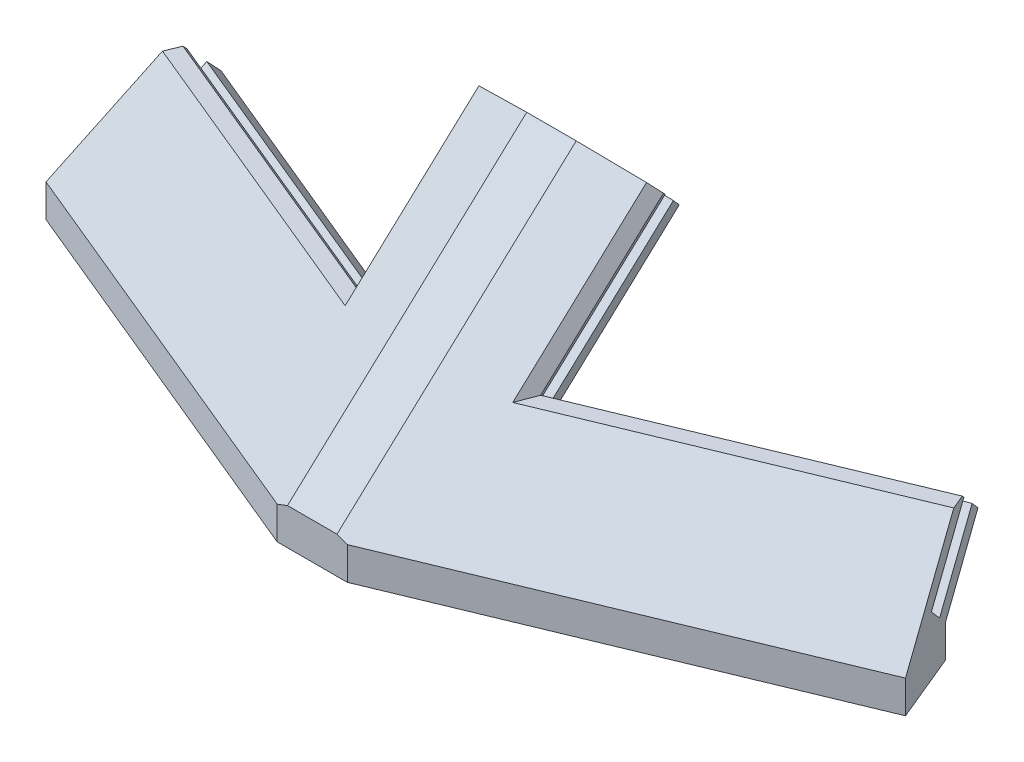
from build123d import *

# Parameters (mm, degrees)
SKETCH1_W                = 214.0895226738578
SKETCH1_H                = 271.0335668448457
BOSS_EXTRUDE1_DEPTH      = 10
SKETCH3_W                = 107.0447613369289
SKETCH3_H                = 271.0335668448457
CUT_EXTRUDE1_DEPTH       = 252.25359017903727
CUT_EXTRUDE2_DEPTH       = 249.55642867000518
BOSS_EXTRUDE3_DEPTH      = 40
CUT_EXTRUDE3_START       = -165.689856025
CUT_EXTRUDE3_DEPTH       = 205.862728092
CUT_EXTRUDE4_DEPTH       = 250.9605933606232
CUT_EXTRUDE5_DEPTH       = 250.96059336062322
BOSS_EXTRUDE5_DEPTH      = 45.000000000000014
CUT_EXTRUDE7_DEPTH       = 253.78419033582136
CUT_EXTRUDE9_DEPTH       = 253.78419033582136
CUT_EXTRUDE10_DEPTH      = 105
BOSS_EXTRUDE6_DEPTH      = 13.546139965279659
BOSS_EXTRUDE7_DEPTH      = 30
CUT_EXTRUDE12_DEPTH      = 30
CUT_EXTRUDE13_DEPTH      = 30
CUT_EXTRUDE14_DEPTH      = 30
CUT_EXTRUDE14_DEPTH_BACK = 101.66514829221025
BOSS_EXTRUDE8_DEPTH      = 5.2
CHAMFER1_START           = 223.359720619
CHAMFER1_OUTLINE_W       = 14
CHAMFER1_OUTLINE_H       = 9.000000000000002
CHAMFER1_DEPTH           = 3.640279381
CHAMFER3_START           = 159.35770891
CHAMFER3_OUTLINE_W       = 10
CHAMFER3_OUTLINE_H       = 51.999999999999986
CHAMFER3_DEPTH           = 1.64229109
CHAMFER4_SIZE            = 1.7


with BuildPart() as part:
    # Sketch1 → Boss-Extrude1 (new body)
    with BuildSketch(Plane(origin=(0, 0, 0), x_dir=(1, 0, 0), z_dir=(0, 1, 0))):
        with Locations((-3.148375333439077, -90.06211454589605)):
            Rectangle(SKETCH1_W, SKETCH1_H)
    extrude(amount=BOSS_EXTRUDE1_DEPTH)

    # Sketch3 → Cut-Extrude1 (cut, through all)
    with BuildSketch(Plane(origin=(0, 10, 0), x_dir=(1, 0, 0), z_dir=(0, 1, 0))):
        with Locations((-56.67075600190353, -90.06211454589605)):
            Rectangle(SKETCH3_W, SKETCH3_H)
    extrude(amount=-CUT_EXTRUDE1_DEPTH, mode=Mode.SUBTRACT)

    # Sketch4 → Cut-Extrude2 (cut, through all)
    with BuildSketch(Plane(origin=(0, 10, 0), x_dir=(1, 0, 0), z_dir=(0, 1, 0))):
        Polygon((103.89638600348982, -181.2395060415717), (100.8349185445691, -173.8484697814814), (9.99658424143476, 45.454668876526796), (103.89638600348982, 45.454668876526796), align=None)
    extrude(amount=-CUT_EXTRUDE2_DEPTH, mode=Mode.SUBTRACT)

    # Sketch6 → Boss-Extrude3 (add, along a direction that is not the sketch's normal)
    with BuildSketch(Plane(origin=(0, 10, 0), x_dir=(1, 0, 0), z_dir=(0, 1, 0))):
        Polygon((99.57206321776432, -170.7996673241942), (103.89638600348982, -181.2395060415717), (-3.148375333439077, -225.57889796831887), (-3.148375333439077, -213.34786610501484), align=None)
    extrude(amount=BOSS_EXTRUDE3_DEPTH, dir=(-0.2705980500730979, 0.7071067811865489, -0.6532814824381872))

    # Cut-Extrude3: read off the stored shape, not the designer's step
    # Cut-Extrude3 outline → Cut-Extrude3 (cut)
    with BuildSketch(Plane(origin=(0, 0, 0), x_dir=(1, 0, 0), z_dir=(0, 0.6785983445458481, -0.7345095552677544)).offset(CUT_EXTRUDE3_START)):
        Polygon((-3.148375333, -165), (-3.148375333, -152.122604304), (-13.972297336, -155.165042499), (-15, -155.45391393), (-15, -165), align=None)
    extrude(amount=CUT_EXTRUDE3_DEPTH, mode=Mode.SUBTRACT)

    # Sketch8 → Cut-Extrude4 (cut, through all)
    with BuildSketch(Plane(origin=(0, 10, 0), x_dir=(1, 0, 0), z_dir=(0, 1, 0))):
        Polygon((-3.1483753334390765, -225.5788979683189), (103.89638600348982, -181.2395060415717), (103.89638600348982, -225.57889796831887), align=None)
    extrude(amount=-CUT_EXTRUDE4_DEPTH, mode=Mode.SUBTRACT)

    # Sketch9 → Cut-Extrude5 (cut, through all)
    with BuildSketch(Plane(origin=(0, 10, 0), x_dir=(1, 0, 0), z_dir=(0, 1, 0))):
        Polygon((-3.1483753334390765, -213.34786610501484), (99.57206321776434, -170.7996673241942), (9.99658424143476, 45.454668876526796), (-3.148375333439077, 45.454668876526796), align=None)
    extrude(amount=-CUT_EXTRUDE5_DEPTH, mode=Mode.SUBTRACT)

    # Sketch13 → Boss-Extrude5 (add)
    with BuildSketch(Plane.XZ):
        Polygon((-3.1483753334390765, 225.5788979683189), (-3.1483753334390765, 213.34786610501484), (99.57206321776434, 170.7996673241942), (103.89638600348982, 181.23950604157167), align=None)
    extrude(amount=BOSS_EXTRUDE5_DEPTH)

    # Sketch14 → Cut-Extrude7 (cut, through all)
    with BuildSketch(Plane(origin=(24.60327067321852, 0, -10.191008391583336), x_dir=(-0.38268343236508967, 0, -0.9238795325112868), z_dir=(0.9238795325112867, 0, -0.3826834323650896))):
        Polygon((-178.9186244729457, 38.28427124746196), (-173.2686244729457, 32.63427124746195), (-167.6186244729457, 38.28427124746196), align=None)
    extrude(amount=-CUT_EXTRUDE7_DEPTH, mode=Mode.SUBTRACT)

    # Sketch21 → Cut-Extrude9 (cut, through all)
    with BuildSketch(Plane(origin=(24.60327067321852, 0, -10.191008391583336), x_dir=(-0.38268343236508967, 0, -0.9238795325112868), z_dir=(0.9238795325112867, 0, -0.3826834323650896))):
        Polygon((-178.9186244729457, 38.28427124746196), (-173.26862447294567, 32.63427124746195), (-186.71050756498246, 19.192388155425135), (-188.37220850077088, 20.854089091213513), (-197.564596656196, 11.661700935788378), (-199.8911947846192, 13.988299064211581), (-190.69880662919408, 23.180687219636717), (-192.3605075649825, 24.84238815542509), align=None)
    extrude(amount=-CUT_EXTRUDE9_DEPTH, mode=Mode.SUBTRACT)

    # Sketch26 → Cut-Extrude10 (cut)
    with BuildSketch(Plane(origin=(24.60327067321852, 0, -10.191008391583336), x_dir=(-0.38268343236508967, 0, -0.9238795325112868), z_dir=(0.9238795325112867, 0, -0.3826834323650896))):
        Polygon((-195.9028957204076, -45.000000000000014), (-207.2028957204075, -45.000000000000014), (-207.20289572040753, 4.999999999999999), (-204.20289572040753, 4.999999999999999), (-204.20289572040753, 10.2), (-198.9028957204076, 10.200000000000001), (-198.9028957204076, 5), (-195.9028957204076, 5), align=None)
    extrude(amount=-CUT_EXTRUDE10_DEPTH, mode=Mode.SUBTRACT)

    # Sketch27 → Boss-Extrude6 (add, along a direction that is not the sketch's normal)
    with BuildSketch(Plane(origin=(35.57097911044696, -92.95144786020374, 85.87594019533113), x_dir=(0.9626924198811571, 0.19875685341551327, -0.18362738881693624), z_dir=(-0.2705980500730966, 0.7071067811865525, -0.6532814824381838))):
        Polygon((-40.21986009681666, -165.94075499699434), (-39.260177114555994, -165.65967035927952), (-38.33532246822035, -168.81732163602243), (-40.219860096816646, -169.36928992803706), align=None)
    extrude(amount=BOSS_EXTRUDE6_DEPTH, dir=(0, 0.6785983445458494, -0.7345095552677533))

    # Sketch28 → Boss-Extrude7 (add, along a direction that is not the sketch's normal)
    with BuildSketch(Plane(origin=(32.05320445949652, -83.75905970477851, 77.38328092363429), x_dir=(0.9626924198811573, 0.1987568534155131, -0.18362738881693524), z_dir=(-0.27059805007309584, 0.7071067811865541, -0.6532814824381823))):
        Polygon((-23.13019805487444, -160.93530887309606), (-23.79074695350427, -158.6800538647835), (-36.56575980652385, -162.4217684996877), (-36.565759806523836, -170.74775403356227), (-21.544794509909032, -166.34821515815156), (-22.205343408538862, -164.09296014983897), (-34.68122217792752, -167.7470604401317), (-35.606076824263106, -164.58940916338878), align=None)
    extrude(amount=BOSS_EXTRUDE7_DEPTH, dir=(0, 0.6785983445458483, -0.7345095552677544))

    # Sketch29 → Cut-Extrude12 (cut)
    with BuildSketch(Plane(origin=(41.559974826961344, 108.60144786020382, 100.33465487913432), x_dir=(0.9626924198811563, -0.1987568534155138, -0.18362738881693985), z_dir=(0.2705980500730995, 0.7071067811865461, 0.6532814824381895))):
        Polygon((-46.44094960872295, -107.03174707988727), (-31.419984312108156, -107.03174707988727), (-31.41998431210815, -102.63220820447661), align=None)
    extrude(amount=-CUT_EXTRUDE12_DEPTH, mode=Mode.SUBTRACT)

    # Sketch30 → Cut-Extrude13 (cut)
    with BuildSketch(Plane(origin=(-72.40408024046648, 0, 29.990752006750984), x_dir=(-0.3826834323650857, 0, -0.9238795325112884), z_dir=(0.9238795325112884, 0, -0.3826834323650857))):
        Polygon((-207.20289572040787, 4.610357956966736), (-207.20289572040795, -45.000000000000014), (-195.90289572040788, -45.000000000000014), (-195.90289572040788, 4.6103579569667374), (-195.9028957204076, 5), (-207.20289572040755, 4.999999999999999), align=None)
    extrude(amount=-CUT_EXTRUDE13_DEPTH, mode=Mode.SUBTRACT)

    # Sketch31 → Cut-Extrude14 (cut, two sides: drawn at the far end of the back side and taken through both)
    with BuildSketch(Plane(origin=(74.968792544546, 0, 180.99067571577757), x_dir=(-0.9238795325112865, 0, 0.38268343236509056), z_dir=(-0.38268343236509056, 0, -0.9238795325112865)).offset(-CUT_EXTRUDE14_DEPTH_BACK)):
        Polygon((18.0534132200626, -1.4270293234233122), (-26.630388278374163, -1.4270293234233173), (-26.630388278374163, 30.311404517874507), (18.0534132200626, 30.311404517874507), align=None)
    extrude(amount=CUT_EXTRUDE14_DEPTH + CUT_EXTRUDE14_DEPTH_BACK, mode=Mode.SUBTRACT)

    # Sketch33 → Boss-Extrude8 (add)
    with BuildSketch(Plane(origin=(1.28e-15, 10.200000000000065, 3.08e-15), x_dir=(-1, 1.3e-16, 0), z_dir=(-1.3e-16, -1, -3e-16))):
        Polygon((-61.46588606719166, -195.56761797257994), (-56.84648840463523, -197.48103513440537), (-54.81826621310026, -192.5844736120956), (-59.437663875656696, -190.67105645027016), align=None)
    extrude(amount=BOSS_EXTRUDE8_DEPTH)

    # Mirror4: part across plane


with BuildPart() as part_1:
    add(part.part)
    add(part.part.mirror(Plane(origin=(-3.148375333439077, 0, 225.57889796831887), x_dir=(0, 0, 1), z_dir=(1, 0, 0))))

    # Chamfer1: read off the stored shape, not the designer's step
    # Chamfer1 outline → Chamfer1 (cut)
    with BuildSketch(Plane.XY.offset(CHAMFER1_START)):
        with Locations((-3, 9.5)):
            Rectangle(CHAMFER1_OUTLINE_W, CHAMFER1_OUTLINE_H)
    extrude(amount=CHAMFER1_DEPTH, mode=Mode.SUBTRACT)

    # Chamfer3: read off the stored shape, not the designer's step
    # Chamfer3 outline → Chamfer3 (cut)
    with BuildSketch(Plane(origin=(0, 0, 0), x_dir=(1, 0, 0), z_dir=(0, 0.7345095552677543, 0.6785983445458483)).offset(CHAMFER3_START)):
        with Locations((-3, -132)):
            Rectangle(CHAMFER3_OUTLINE_W, CHAMFER3_OUTLINE_H)
    extrude(amount=CHAMFER3_DEPTH, mode=Mode.SUBTRACT)

    # Chamfer4
    chamfer4_edges = [part_1.edges().sort_by_distance(p)[0] for p in [
        (34.12309720869192, 24.84238815542509, 194.07526337860742),
        (11.312194096909927, 33.52860342480338, 194.1219571598504),
        (-17.60894476378808, 33.52860342480338, 194.1219571598504),
        (-40.41984787557007, 24.84238815542509, 194.07526337860742),
    ]]
    chamfer(chamfer4_edges, length=CHAMFER4_SIZE)


solid = part_1.part
